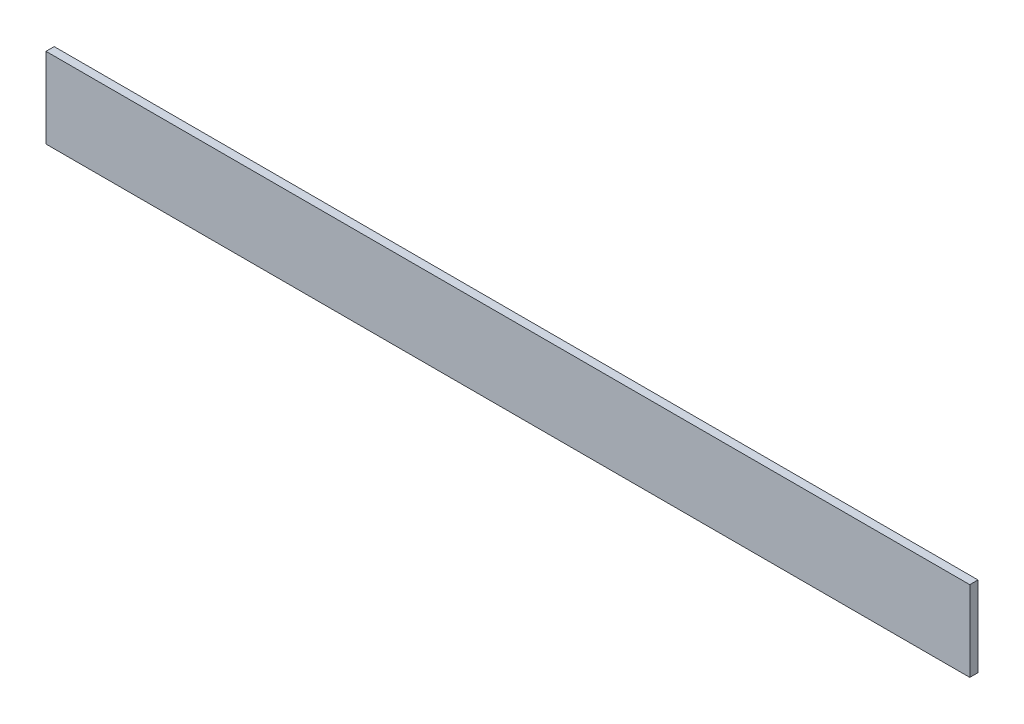
from build123d import *

# Parameters (mm, degrees)
SKETCH1_W           = 506
SKETCH1_H           = 44
BOSS_EXTRUDE1_DEPTH = 4.5


with BuildPart() as part:
    # Sketch1 → Boss-Extrude1 (new body)
    with BuildSketch(Plane.XY):
        Rectangle(SKETCH1_W, SKETCH1_H)
    extrude(amount=BOSS_EXTRUDE1_DEPTH)


solid = part.part
